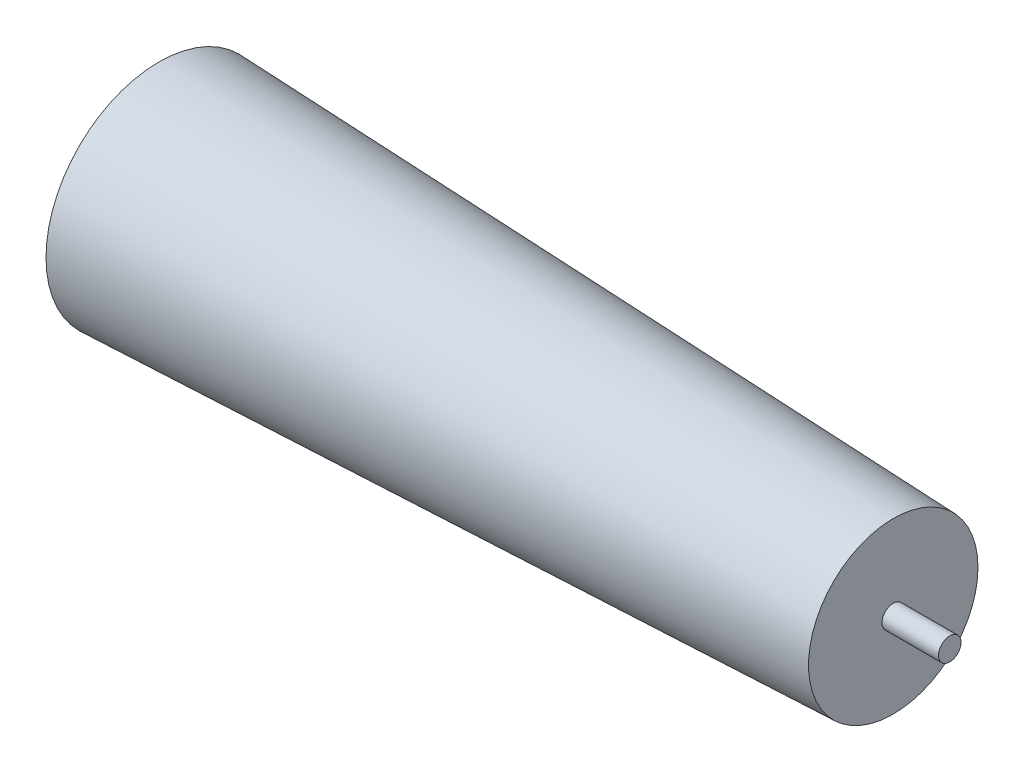
from build123d import *

# Parameters (mm, degrees)
SKETCH1_R                = 40
SKETCH2_R                = 30
BOSS_EXTRUDE1_DEPTH      = 20
BOSS_EXTRUDE1_DEPTH_BACK = 280
SKETCH3_R                = 4


with BuildPart() as part:
    # Sketch1 → Loft1 section 0
    with BuildSketch(Plane(origin=(0, 0, 0), x_dir=(0, 0, -1), z_dir=(1, 0, 0))):
        Circle(SKETCH1_R)
    # Sketch2 → Loft1 section 1
    with BuildSketch(Plane(origin=(260, 0, 0), x_dir=(0, 0, -1), z_dir=(1, 0, 0))):
        Circle(SKETCH2_R)
    loft()

    # Sketch3 → Boss-Extrude1 (add, two sides: drawn at the far end of the back side and taken through both)
    with BuildSketch(Plane(origin=(260, 0, 0), x_dir=(0, 0, -1), z_dir=(1, 0, 0)).offset(-BOSS_EXTRUDE1_DEPTH_BACK)):
        Circle(SKETCH3_R)
    extrude(amount=BOSS_EXTRUDE1_DEPTH + BOSS_EXTRUDE1_DEPTH_BACK)


solid = part.part
